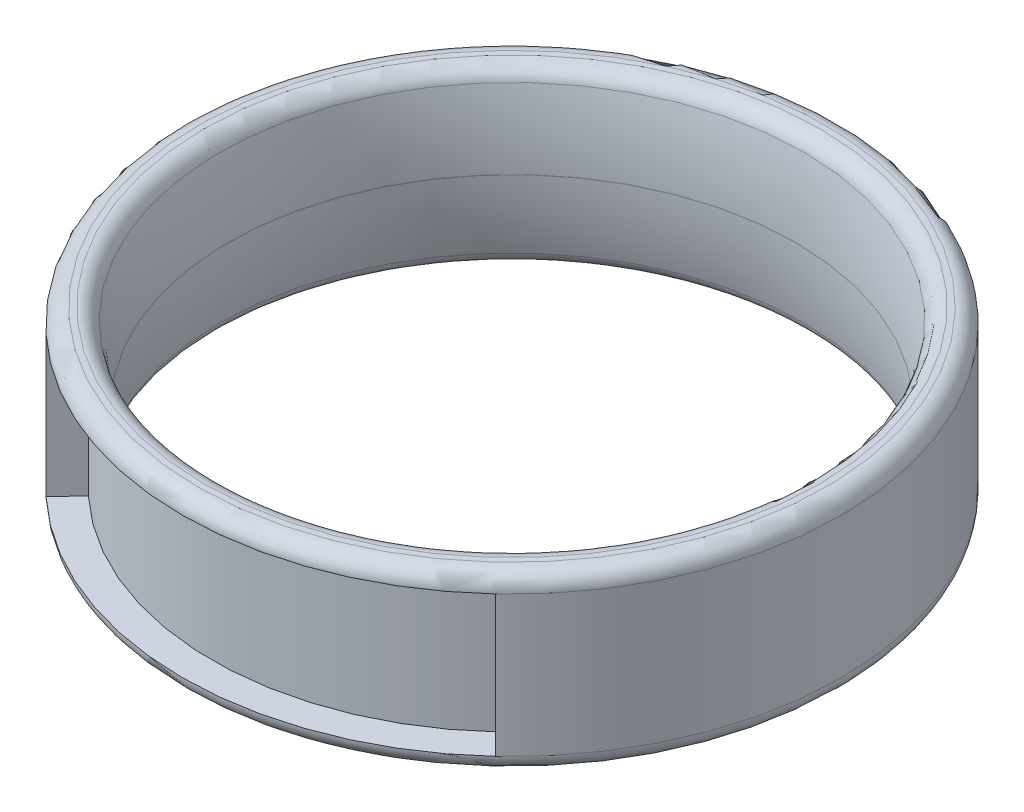
from build123d import *

# Parameters (mm, degrees)
BOSS_EXTRUDE1_DEPTH      = 3.75
BOSS_EXTRUDE1_DEPTH_BACK = 3.75
SKETCH1_R                = 14.3
SKETCH1_R_2              = 12.3
FILLET1_R                = 0.7
FILLET3_R                = 0.7
CUT_REVOLVE2_START       = -3.05
CUT_REVOLVE2_DEPTH       = 6.1


# Read off the part's stored shape, not the designer's step: Cut-Revolve2
with BuildPart() as part:
    # Sketch1 → Boss-Extrude1 (new, two sides: drawn at the far end of the back side and taken through both)
    with BuildSketch(Plane(origin=(0, 0, 0), x_dir=(1, 0, 0), z_dir=(0, 1, 0)).offset(-BOSS_EXTRUDE1_DEPTH_BACK)):
        with Locations(Location((0, 0, 0), (0, 0, 270))):
            Circle(SKETCH1_R)
        with Locations(Location((0, 0, 0), (0, 0, 270))):
            Circle(SKETCH1_R_2, mode=Mode.SUBTRACT)
    extrude(amount=BOSS_EXTRUDE1_DEPTH + BOSS_EXTRUDE1_DEPTH_BACK)

    # Fillet1
    fillet1_edges = [part.edges().sort_by_distance(p)[0] for p in [
        (0, -3.75, -14.3),
        (0, 3.75, -14.3),
    ]]
    fillet(fillet1_edges, radius=FILLET1_R)

    # Sketch3 → Cut-Revolve1 (revolve, cut)
    with BuildSketch(Plane(origin=(0, 0, 0), x_dir=(0, 0, -1), z_dir=(1, 0, 0)), mode=Mode.PRIVATE) as cut_revolve1_sk:
        with BuildLine():
            Line((-12.3, 3.75), (-12.3, 0.005))
            ThreePointArc((-12.3, 0.005), (-12.431616425, 1.893305551), (-12.8, 3.75))
            Line((-12.8, 3.75), (-12.3, 3.75))
        make_face()
        with BuildLine():
            Line((-12.3, -3.75), (-12.8, -3.75))
            ThreePointArc((-12.8, -3.75), (-12.431616425, -1.893305551), (-12.3, -0.005))
            Line((-12.3, -0.005), (-12.3, -3.75))
        make_face()
    revolve(cut_revolve1_sk.sketch.rotate(Axis((0, 0, 0), (0, 1, 0)), 180), axis=Axis((0, 0, 0), (0, 1, 0)), mode=Mode.SUBTRACT)

    # Fillet3
    fillet3_edges = [part.edges().sort_by_distance(p)[0] for p in [
        (0, 3.75, 12.8),
        (0, -3.75, 12.8),
    ]]
    fillet(fillet3_edges, radius=FILLET3_R)

    # Cut-Revolve2 outline → Cut-Revolve2 (cut)
    with BuildSketch(Plane(origin=(0, 0, 0), x_dir=(1, 0, 0), z_dir=(0, 1, 0)).offset(CUT_REVOLVE2_START)):
        with BuildLine():
            ThreePointArc((-8.865978681, 9.507598121), (0, 13), (8.865978681, 9.507598121))
            Line((8.865978681, 9.507598121), (9.752576549, 10.458357933))
            ThreePointArc((9.752576549, 10.458357933), (0, 14.3), (-9.752576549, 10.458357933))
            Line((-9.752576549, 10.458357933), (-8.865978681, 9.507598121))
        make_face()
    cut_revolve2 = extrude(amount=CUT_REVOLVE2_DEPTH, mode=Mode.SUBTRACT)

    # Mirror3: Cut-Revolve2 across plane
    add(cut_revolve2.mirror(Plane.XY), mode=Mode.SUBTRACT)


solid = part.part
